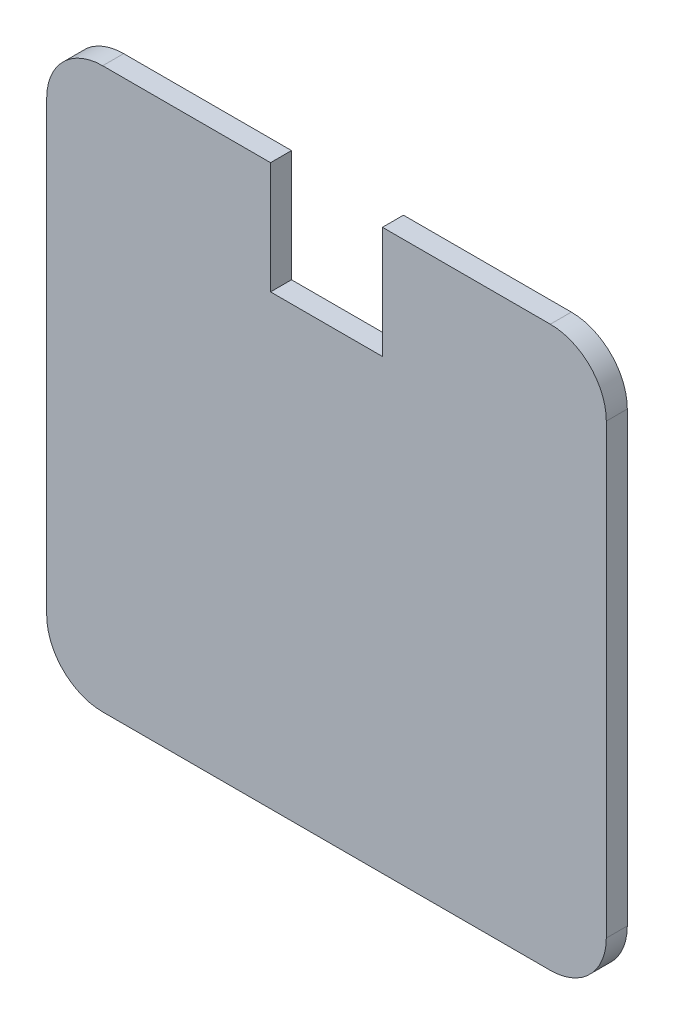
from build123d import *

# Parameters (mm, degrees)
BOSS_EXTRUDE1_DEPTH = 4.7625


with BuildPart() as part:
    # Sketch1 → Boss-Extrude1 (new body)
    with BuildSketch(Plane.XY):
        with BuildLine():
            Line((-63.5, 50.8), (-63.5, -50.8))
            ThreePointArc((-63.5, -50.8), (-59.780256121, -59.780256121), (-50.8, -63.5))
            Line((-50.8, -63.5), (50.8, -63.5))
            ThreePointArc((50.8, -63.5), (59.780256121, -59.780256121), (63.5, -50.8))
            Line((63.5, -50.8), (63.5, 50.8))
            ThreePointArc((63.5, 50.8), (59.780256121, 59.780256121), (50.8, 63.5))
            Line((50.8, 63.5), (12.7, 63.5))
            Line((12.7, 63.5), (12.7, 38.1))
            Line((12.7, 38.1), (-12.7, 38.1))
            Line((-12.7, 38.1), (-12.7, 63.5))
            Line((-12.7, 63.5), (-50.8, 63.5))
            ThreePointArc((-50.8, 63.5), (-59.780256121, 59.780256121), (-63.5, 50.8))
        make_face()
    extrude(amount=BOSS_EXTRUDE1_DEPTH)


solid = part.part
